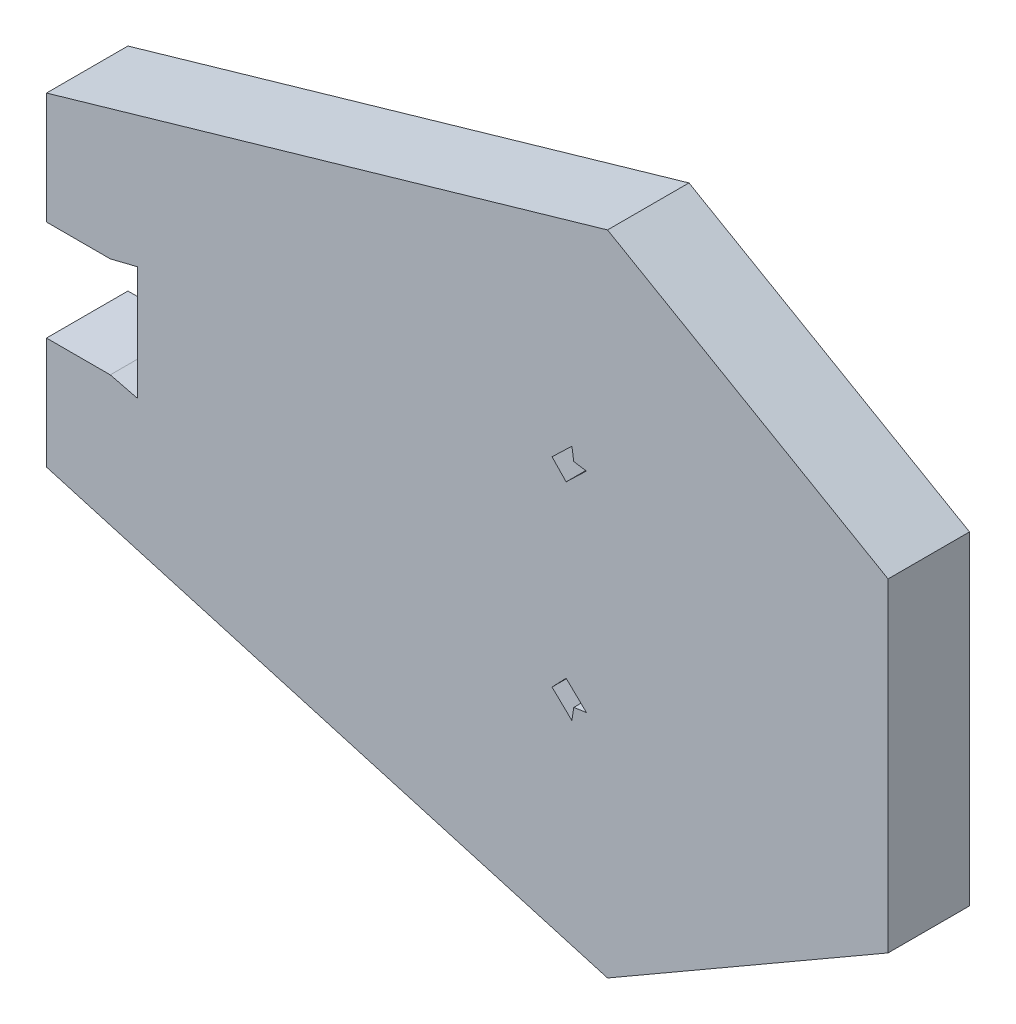
from build123d import *

# Parameters (mm, degrees)
BOSS_EXTRUDE1_DEPTH = 6


with BuildPart() as part:
    # Sketch1 → Boss-Extrude1 (new body)
    with BuildSketch(Plane.XY):
        Polygon((25.85, 11.931905563), (5.183333333, 23.863811127), (-36.15, 11.931905563), (-36.15, 3.7), (-31.45, 3.7), (-29.45, 4.196645837), (-29.45, -4.196645837), (-31.45, -3.7), (-36.15, -3.7), (-36.15, -11.931905563), (5.183333333, -23.863811127), (25.85, -11.931905563), align=None)
        Polygon((2.557789389, 8.752941165), (2.694582377, 7.844582377), (3.629791813, 7.703745854), (2.132731769, 6.264613533), (1.093682273, 7.345486682), align=None, mode=Mode.SUBTRACT)
        Polygon((2.557789389, -8.752941165), (1.093682273, -7.345486682), (2.132731769, -6.264613533), (3.629791813, -7.703745854), (2.694582377, -7.844582377), align=None, mode=Mode.SUBTRACT)
    extrude(amount=BOSS_EXTRUDE1_DEPTH)


solid = part.part
